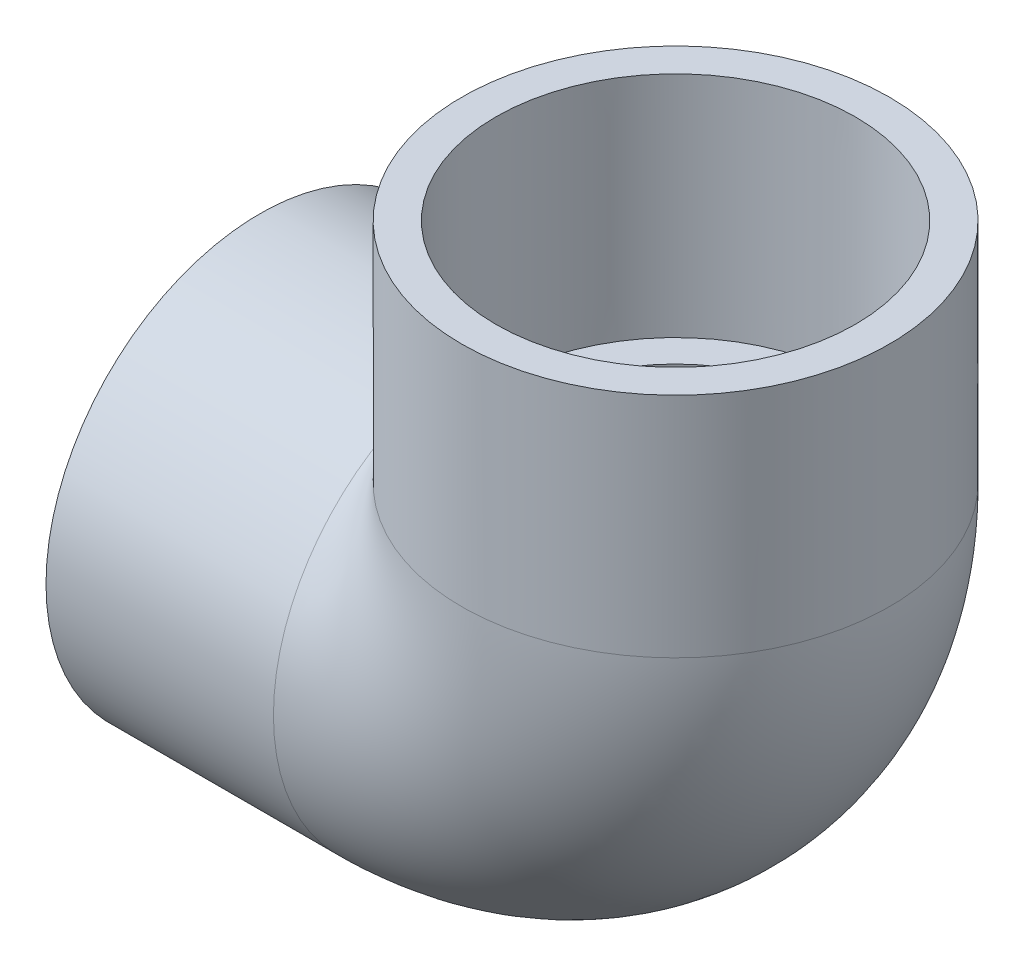
from build123d import *

# Parameters (mm, degrees)
SKETCH3_R   = 36.068
SKETCH3_R_2 = 24.6253


with BuildPart() as part:
    # Sketch1 → Revolve1 (revolve)
    with BuildSketch(Plane.XY):
        Polygon((-70.104, -36.068), (-31.75, -36.068), (-31.75, -30.0863), (-70.104, -30.3149), align=None)
    revolve(axis=Axis((-70.104, 0, 0), (1, 0, 0)))


with BuildPart() as body_2:
    # Sketch2 → Revolve2 (revolve)
    with BuildSketch(Plane.XY):
        Polygon((30.3149, 70.104), (30.0863, 31.75), (36.068, 31.75), (36.068, 70.104), align=None)
    revolve(axis=Axis((0, 0, 0), (0, 1, 0)))


with BuildPart() as sweep1_tool:
    # Sweep1: sweep along a path in Sketch4
    with BuildLine(Plane.XY) as sweep1_path:
        ThreePointArc((-31.75, 0), (-9.29936, 9.29936), (0, 31.75))
    # Sketch3 → Sweep1 (sweep)
    with BuildSketch(Plane(origin=(-31.75, 0, 0), x_dir=(0, 0, -1), z_dir=(1, 0, 0))):
        Circle(SKETCH3_R)
        Circle(SKETCH3_R_2, mode=Mode.SUBTRACT)
    sweep(path=sweep1_path.line)


with BuildPart() as part_1:
    add(part.part)


with BuildPart() as part_2:
    # Sweep1: joined with sweep1_tool
    add(part_1.part.fuse(sweep1_tool.part, body_2.part, tol=0.00001))


solid = part_2.part
